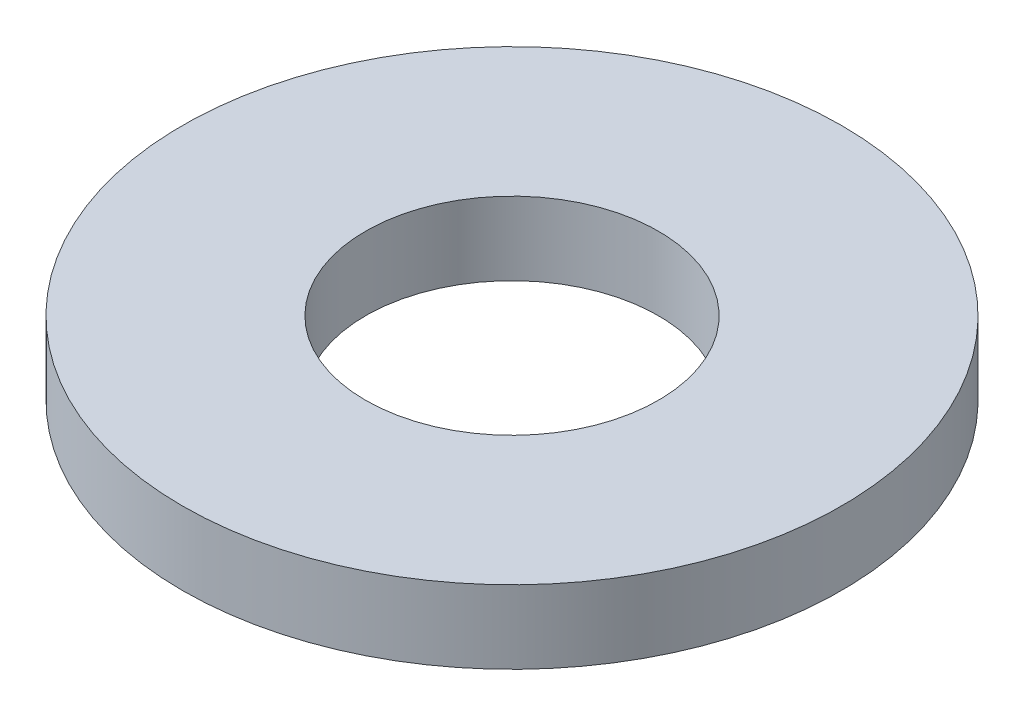
from build123d import *

# Parameters (mm, degrees)
SKETCH1_R           = 67.5
BOSS_EXTRUDE1_DEPTH = 15
SKETCH2_R           = 30
CUT_EXTRUDE1_DEPTH  = 97.63074045


with BuildPart() as part:
    # Sketch1 → Boss-Extrude1 (new body)
    with BuildSketch(Plane(origin=(0, 0, 0), x_dir=(1, 0, 0), z_dir=(0, 1, 0))):
        Circle(SKETCH1_R)
    extrude(amount=BOSS_EXTRUDE1_DEPTH)

    # Sketch2 → Cut-Extrude1 (cut, through all)
    with BuildSketch(Plane(origin=(0, 0, 0), x_dir=(1, 0, 0), z_dir=(0, 1, 0))):
        Circle(SKETCH2_R)
    extrude(amount=CUT_EXTRUDE1_DEPTH, mode=Mode.SUBTRACT)


solid = part.part
